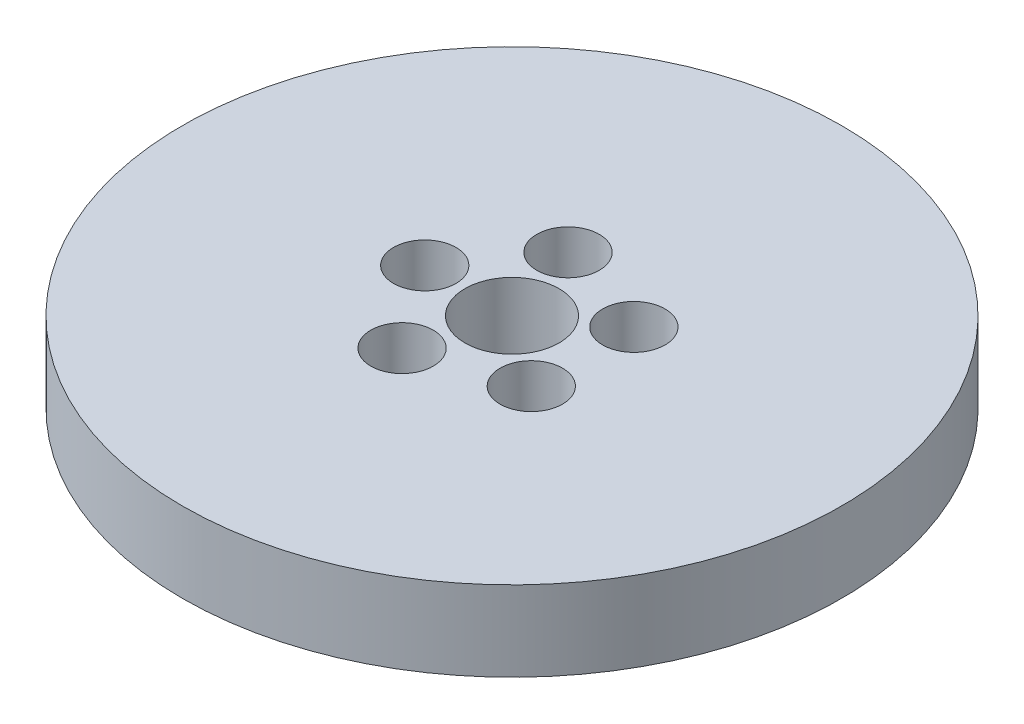
from build123d import *

# Parameters (mm, degrees)
SKETCH1_R           = 70
BOSS_EXTRUDE1_DEPTH = 17
SKETCH2_R           = 10
CUT_EXTRUDE1_DEPTH  = 101.444014257
SKETCH3_R           = 6.632904827
CUT_EXTRUDE2_DEPTH  = 14.365844755
CIRPATTERN1_COUNT   = 5


with BuildPart() as part:
    # Sketch1 → Boss-Extrude1 (new body)
    with BuildSketch(Plane(origin=(0, 0, 0), x_dir=(1, 0, 0), z_dir=(0, 1, 0))):
        Circle(SKETCH1_R)
    extrude(amount=BOSS_EXTRUDE1_DEPTH)

    # Sketch2 → Cut-Extrude1 (cut, through all)
    with BuildSketch(Plane(origin=(0, 0, 0), x_dir=(1, 0, 0), z_dir=(0, 1, 0))):
        Circle(SKETCH2_R)
    extrude(amount=CUT_EXTRUDE1_DEPTH, mode=Mode.SUBTRACT)

    # Sketch3 → Cut-Extrude2 (cut)
    with BuildSketch(Plane(origin=(0, 17, 0), x_dir=(1, 0, 0), z_dir=(0, 1, 0))):
        with Locations((-18.531271386, 0)):
            Circle(SKETCH3_R)
    cut_extrude2 = extrude(amount=-CUT_EXTRUDE2_DEPTH, mode=Mode.SUBTRACT)

    # CirPattern1: Cut-Extrude2 ×5 about axis
    cirpattern1_axis = Axis((0, 0, 0), (0, 1, 0))
    for i in range(1, CIRPATTERN1_COUNT):
        add(cut_extrude2.rotate(cirpattern1_axis, i * 360 / CIRPATTERN1_COUNT), mode=Mode.SUBTRACT)


solid = part.part
